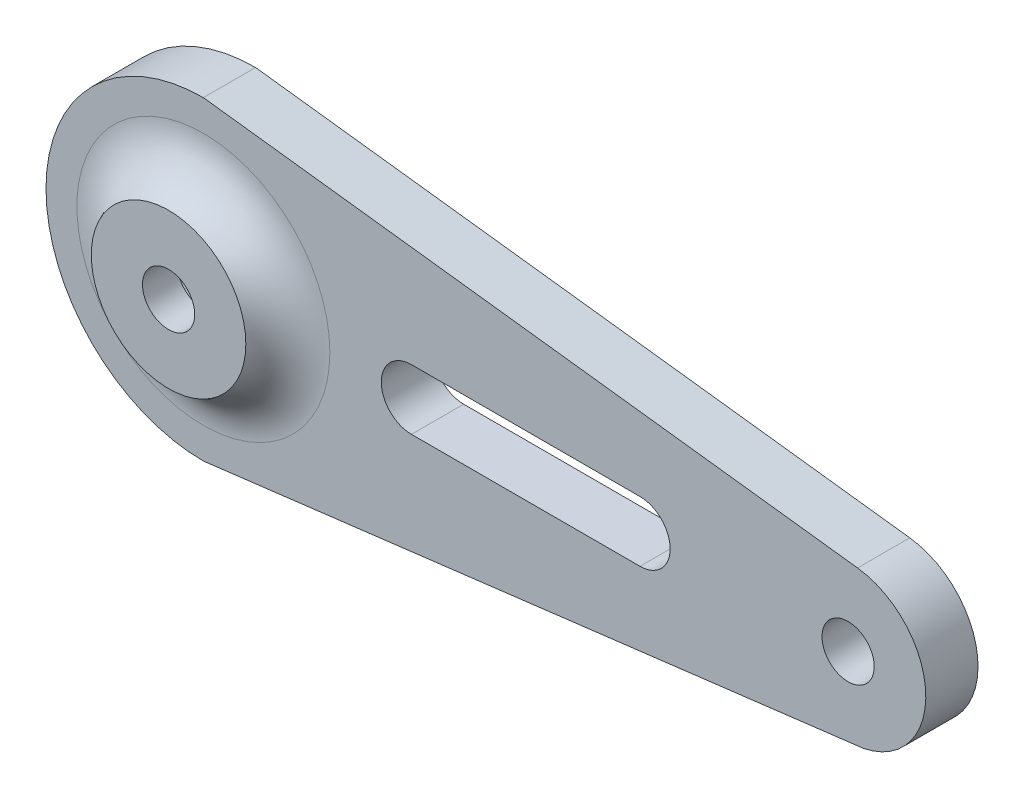
from build123d import *

# Parameters (mm, degrees)
SKETCH1_R           = 3
SKETCH1_R_2         = 1.5
BOSS_EXTRUDE1_DEPTH = 3
SKETCH2_R           = 4.440231585
SKETCH2_R_2         = 1.5
BOSS_EXTRUDE2_DEPTH = 2
FILLET1_R           = 3


with BuildPart() as part:
    # Sketch1 → Boss-Extrude1 (new body)
    with BuildSketch(Plane.XY):
        with BuildLine():
            Line((-33.316424849, 111.282839546), (-70.905727769, 115.89291218))
            ThreePointArc((-70.905727769, 115.89291218), (-79.948137164, 106.850502785), (-70.905727769, 97.808093391))
            Line((-70.905727769, 97.808093391), (-33.676430248, 102.388731808))
            Line((-33.676430248, 102.388731808), (-32.956569458, 102.477302429))
            ThreePointArc((-32.956569458, 102.477302429), (-29.398198623, 107.032843823), (-33.316424849, 111.282839546))
        make_face()
        with Locations((-70.905727769, 106.850502785)):
            Circle(SKETCH1_R, mode=Mode.SUBTRACT)
        with BuildLine():
            ThreePointArc((-45.817442834, 108.585056612), (-44.082889007, 106.850502785), (-45.817442834, 105.115948958))
            Line((-45.817442834, 105.115948958), (-58.948305776, 105.115948958))
            ThreePointArc((-58.948305776, 105.115948958), (-60.682859603, 106.850502785), (-58.948305776, 108.585056612))
            Line((-58.948305776, 108.585056613), (-45.817442834, 108.585056613))
        make_face(mode=Mode.SUBTRACT)
        with Locations((-33.860020841, 106.850502785)):
            Circle(SKETCH1_R_2, mode=Mode.SUBTRACT)
    extrude(amount=BOSS_EXTRUDE1_DEPTH)

    # Sketch2 → Boss-Extrude2 (add)
    with BuildSketch(Plane.XY.offset(3)):
        with Locations((-70.905727769, 106.850502785)):
            Circle(SKETCH2_R)
        with Locations((-70.905727769, 106.850502785)):
            Circle(SKETCH2_R_2, mode=Mode.SUBTRACT)
    extrude(amount=BOSS_EXTRUDE2_DEPTH)

    # Fillet1
    # the kernel refuses this fillet: 3 mm, written as the material it adds along each edge
    with BuildSketch(Plane(origin=(-70.905727769, 106.850502785, 3), x_dir=(1, 0, 0), z_dir=(0, -1, 0))) as fillet1_piece_1:
        with BuildLine():
            CenterArc((7.26865871, 3), FILLET1_R, 199.471220634, 70.528779366)
            Line((4.440231585, 2), (4.383663043, 1.98))
            ThreePointArc((4.383663043, 1.98), (4.380231585, 1), (4.380231585, 0))
            Line((4.380231585, 0), (4.440231585, -0.06))
            Line((4.440231585, -0.06), (7.26865871, -0.06))
            Line((7.26865871, -0.06), (7.26865871, 0))
        make_face()
    revolve(axis=Axis((-70.905727769, 106.850502785, 3), (0, 0, 1)))


solid = part.part
